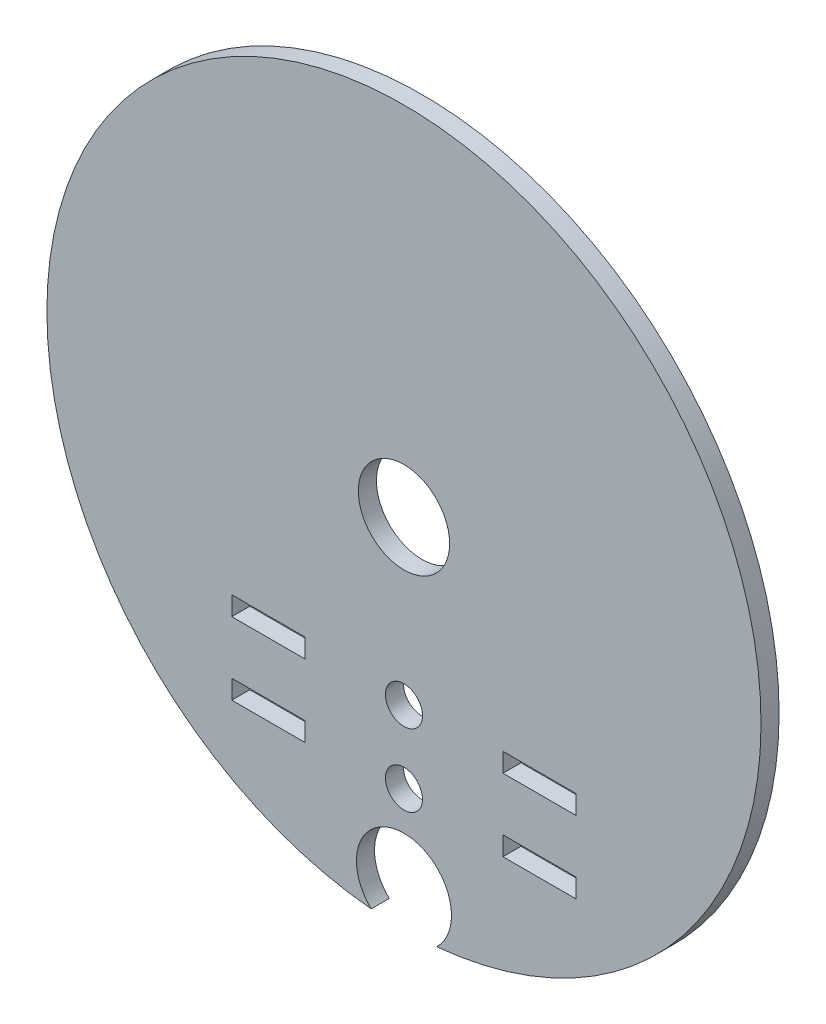
from build123d import *

# Parameters (mm, degrees)
SKETCH_1_R      = 2.05
SKETCH_1_R_2    = 5.05
SKETCH_1_W      = 8.1
SKETCH_1_H      = 2.1
EXTRUDE_1_DEPTH = 2


with BuildPart() as part:
    # 草图1 → 凸台-拉伸1 (new body)
    with BuildSketch(Plane.XY):
        with BuildLine():
            ThreePointArc((-3.624454051, -13.333361576), (-0.001607787, -4.270377749), (3.62027571, -13.333746374))
            ThreePointArc((3.62027571, -13.333746374), (0.002098011, 65.499999944), (-3.624454051, -13.333361576))
        make_face()
        Circle(SKETCH_1_R, mode=Mode.SUBTRACT)
        with Locations((0, 8)):
            Circle(SKETCH_1_R, mode=Mode.SUBTRACT)
        with Locations((0, 26)):
            Circle(SKETCH_1_R_2, mode=Mode.SUBTRACT)
        with Locations((-15, 8)):
            Rectangle(SKETCH_1_W, SKETCH_1_H, mode=Mode.SUBTRACT)
        with Locations((-15, 0)):
            Rectangle(SKETCH_1_W, SKETCH_1_H, mode=Mode.SUBTRACT)
        with Locations((15, 8)):
            Rectangle(SKETCH_1_W, SKETCH_1_H, mode=Mode.SUBTRACT)
        with Locations((15, 0)):
            Rectangle(SKETCH_1_W, SKETCH_1_H, mode=Mode.SUBTRACT)
    extrude(amount=EXTRUDE_1_DEPTH)


solid = part.part
